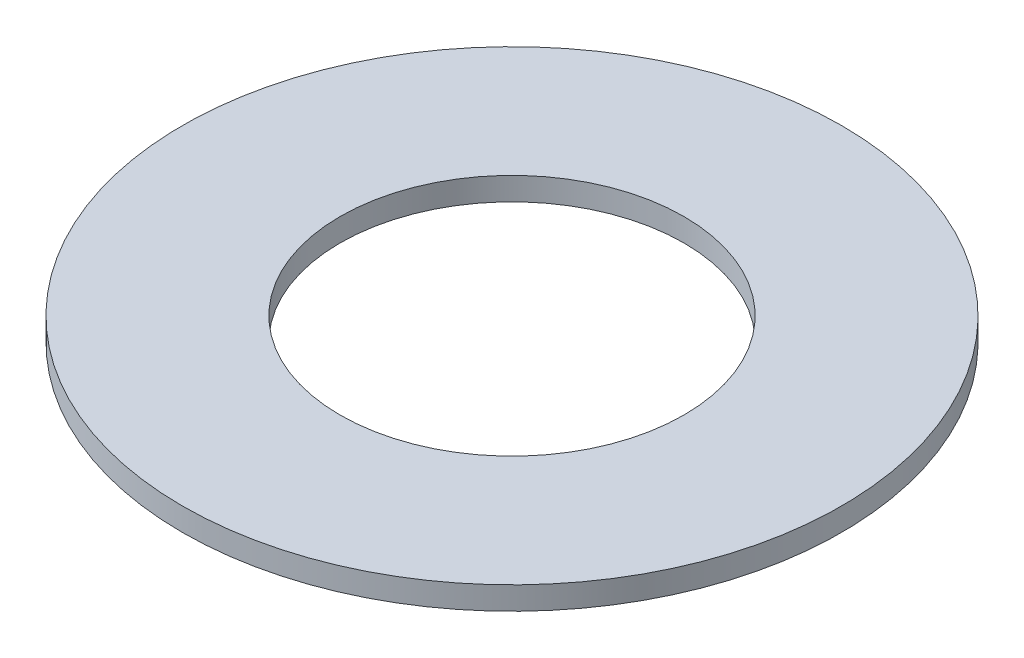
from build123d import *

# Parameters (mm, degrees)
SKETCH1_R           = 57.5
BOSS_EXTRUDE1_DEPTH = 4
SKETCH2_R           = 30
CUT_EXTRUDE1_DEPTH  = 82.415600471


with BuildPart() as part:
    # Sketch1 → Boss-Extrude1 (new body)
    with BuildSketch(Plane(origin=(0, 0, 0), x_dir=(1, 0, 0), z_dir=(0, 1, 0))):
        Circle(SKETCH1_R)
    extrude(amount=BOSS_EXTRUDE1_DEPTH)

    # Sketch2 → Cut-Extrude1 (cut, through all)
    with BuildSketch(Plane(origin=(0, 0, 0), x_dir=(1, 0, 0), z_dir=(0, 1, 0))):
        Circle(SKETCH2_R)
    extrude(amount=CUT_EXTRUDE1_DEPTH, mode=Mode.SUBTRACT)


solid = part.part
